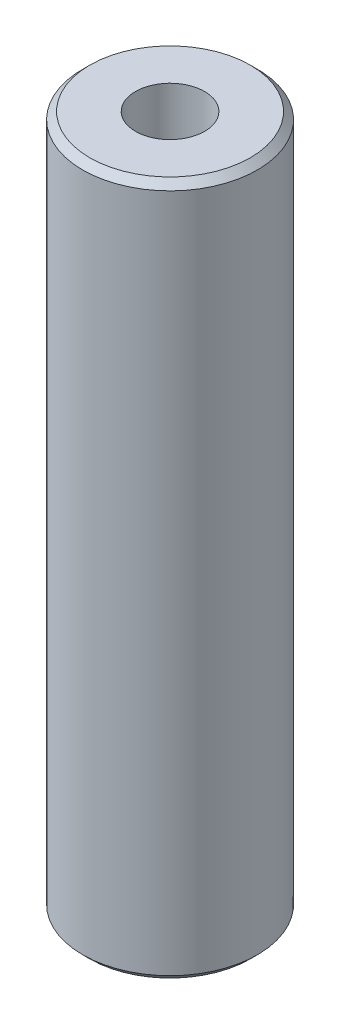
from build123d import *

# Parameters (mm, degrees)
SKETCH1_R           = 42.5
BOSS_EXTRUDE1_DEPTH = 337.633012159
SKETCH2_R           = 16.82201931
CUT_EXTRUDE1_DEPTH  = 343.941031227
CHAMFER1_SIZE       = 3.436902575


with BuildPart() as part:
    # Sketch1 → Boss-Extrude1 (new body)
    with BuildSketch(Plane(origin=(0, 0, 0), x_dir=(1, 0, 0), z_dir=(0, 1, 0))):
        Circle(SKETCH1_R)
    extrude(amount=BOSS_EXTRUDE1_DEPTH)

    # Sketch2 → Cut-Extrude1 (cut, through all)
    with BuildSketch(Plane(origin=(0, 0, 0), x_dir=(1, 0, 0), z_dir=(0, 1, 0))):
        Circle(SKETCH2_R)
    extrude(amount=CUT_EXTRUDE1_DEPTH, mode=Mode.SUBTRACT)

    # Chamfer1
    chamfer1_edges = [part.edges().sort_by_distance(p)[0] for p in [
        (-42.5, 337.633012159, 0),
        (-42.5, 0, 0),
    ]]
    chamfer(chamfer1_edges, length=CHAMFER1_SIZE)


solid = part.part
